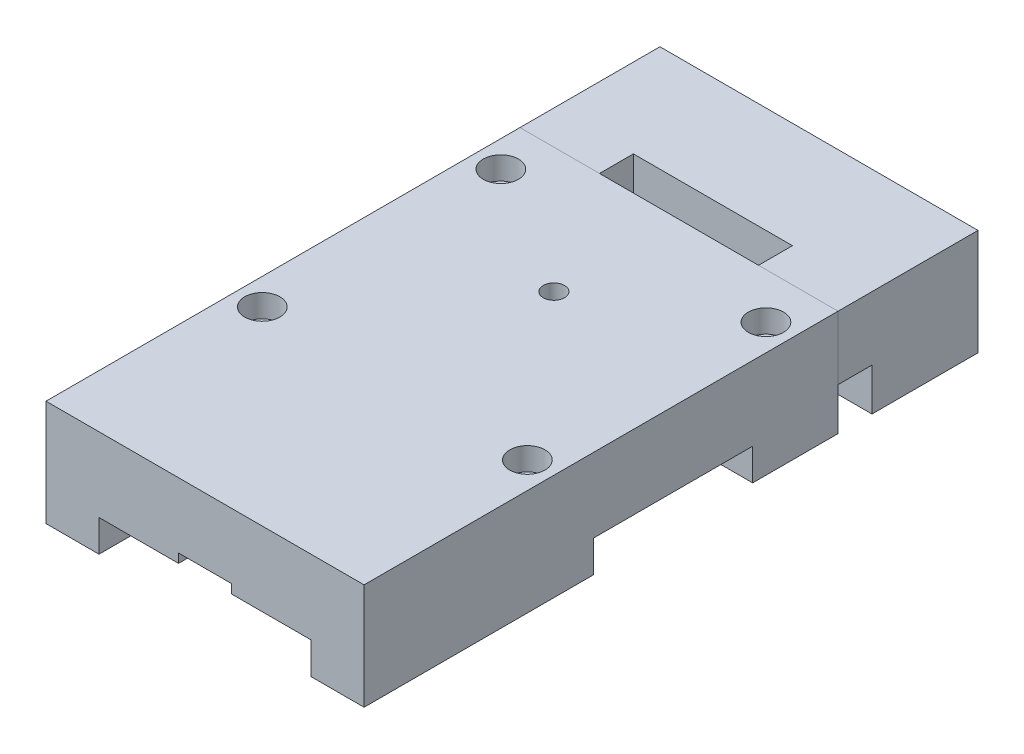
from build123d import *

# Parameters (mm, degrees)
BOSS_EXTRUDE1_DEPTH         = 12.7
BOSS_EXTRUDE1_DEPTH_BACK    = 12.7
SKETCH1_W                   = 76.2
SKETCH1_H                   = 147.066
SKETCH2_R                   = 4.7625
CUT_EXTRUDE1_DEPTH          = 25.4
CUT_EXTRUDE2_DEPTH          = 7.62
CUT_EXTRUDE4_DEPTH          = 84.785452729
CUT_EXTRUDE4_DEPTH_BACK     = 84.785452729
SKETCH5_W                   = 38.1
SKETCH5_H                   = 8.128
F_1_4_20_TAPPED_HOLE1_D     = 5.1054
F_1_4_20_TAPPED_HOLE1_DEPTH = 19.05
F_1_4_20_TAPPED_HOLE1_TIP   = 1.533816902
SKETCH9_R                   = 2.5527
CUT_EXTRUDE5_DEPTH          = 87.62489301
CUT_EXTRUDE7_DEPTH          = 2.159
SKETCH12_R                  = 2.0193
CUT_EXTRUDE8_DEPTH          = 12.7
SKETCH13_W                  = 19.05
SKETCH13_H                  = 8.128
CUT_EXTRUDE9_DEPTH          = 10.16
SKETCH15_R                  = 2.0193
CUT_EXTRUDE11_DEPTH         = 57.15
SKETCH17_R                  = 4.2164
CUT_EXTRUDE12_DEPTH         = 5.461
SKETCH18_R                  = 4.2164
CUT_EXTRUDE13_DEPTH         = 5.461
SKETCH19_R                  = 2.0193
CUT_EXTRUDE14_DEPTH         = 12.7
CUT_EXTRUDE16_DEPTH         = 2.286
CUT_EXTRUDE18_DEPTH         = 11.176


with BuildPart() as part:
    # Sketch1 → Boss-Extrude1 (new, two sides: drawn at the far end of the back side and taken through both)
    with BuildSketch(Plane(origin=(0, 0, 0), x_dir=(1, 0, 0), z_dir=(0, 1, 0)).offset(-BOSS_EXTRUDE1_DEPTH_BACK)):
        Rectangle(SKETCH1_W, SKETCH1_H)
    extrude(amount=BOSS_EXTRUDE1_DEPTH + BOSS_EXTRUDE1_DEPTH_BACK)

    # Sketch2 → Cut-Extrude1 (cut)
    with BuildSketch(Plane(origin=(0, 0, -73.533), x_dir=(-1, 0, 0), z_dir=(0, 0, -1))):
        with Locations((0, -12.7)):
            Circle(SKETCH2_R)
    extrude(amount=-CUT_EXTRUDE1_DEPTH, mode=Mode.SUBTRACT)

    # Sketch3 → Cut-Extrude2 (cut)
    with BuildSketch(Plane(origin=(0, -12.7, 0), x_dir=(-1, 0, 0), z_dir=(0, -1, 0))):
        with BuildLine():
            Line((10.922, 19.558), (44.45, 19.558))
            Line((44.45, 19.558), (44.45, -18.542))
            Line((44.45, -18.542), (25.4, -18.542))
            Line((25.4, -18.542), (25.4, -76.708))
            ThreePointArc((25.4, -76.708), (23.540128061, -81.198128061), (19.05, -83.058))
            Line((19.05, -83.058), (-19.05, -83.058))
            ThreePointArc((-19.05, -83.058), (-23.540128061, -81.198128061), (-25.4, -76.708))
            Line((-25.4, -76.708), (-25.4, -18.542))
            Line((-25.4, -18.542), (-44.45, -18.542))
            Line((-44.45, -18.542), (-44.45, 19.558))
            Line((-44.45, 19.558), (-10.922, 19.558))
            Line((-10.922, 19.558), (-10.922, 40.005))
            Line((-10.922, 40.005), (10.922, 40.005))
            Line((10.922, 40.005), (10.922, 19.558))
        make_face()
    extrude(amount=-CUT_EXTRUDE2_DEPTH, mode=Mode.SUBTRACT)

    # Sketch5 → Cut-Extrude4 (cut, two sides: drawn at the far end of the back side and taken through both)
    with BuildSketch(Plane(origin=(0, 0, 0), x_dir=(1, 0, 0), z_dir=(0, 1, 0)).offset(-CUT_EXTRUDE4_DEPTH_BACK)):
        with Locations((0, 44.069)):
            Rectangle(SKETCH5_W, SKETCH5_H)
    extrude(amount=CUT_EXTRUDE4_DEPTH + CUT_EXTRUDE4_DEPTH_BACK, mode=Mode.SUBTRACT)

    # 1/4-20 Tapped Hole1
    with Locations(Plane(origin=(-11.034450397, 12.7, 14.547513529), x_dir=(-1, 0, 0), z_dir=(0, 1, 0))):
        with Locations((-11.034450397, -24.580513529)):
            Hole(F_1_4_20_TAPPED_HOLE1_D / 2, depth=F_1_4_20_TAPPED_HOLE1_DEPTH)
            with Locations((0, 0, -(F_1_4_20_TAPPED_HOLE1_DEPTH + F_1_4_20_TAPPED_HOLE1_TIP / 2))):  # 118° drill point
                Cone(0, F_1_4_20_TAPPED_HOLE1_D / 2, F_1_4_20_TAPPED_HOLE1_TIP, mode=Mode.SUBTRACT)

    # Sketch9 → Cut-Extrude5 (cut, through all)
    with BuildSketch(Plane(origin=(0, -12.7, 0), x_dir=(-1, 0, 0), z_dir=(0, -1, 0))):
        with Locations((31.75, 29.083)):
            Circle(SKETCH9_R)
        with Locations((31.75, -28.067)):
            Circle(SKETCH9_R)
        with Locations((-31.75, -28.067)):
            Circle(SKETCH9_R)
        with Locations((-31.75, 29.083)):
            Circle(SKETCH9_R)
    extrude(amount=-CUT_EXTRUDE5_DEPTH, mode=Mode.SUBTRACT)

    # Sketch11 → Cut-Extrude7 (cut)
    with BuildSketch(Plane(origin=(0, -5.08, 0), x_dir=(-1, 0, 0), z_dir=(0, -1, 0))):
        with BuildLine():
            Line((0.00254, -32.893), (-0.00254, -32.893))
            ThreePointArc((-0.00254, -32.893), (-4.490872009, -34.752127991), (-6.35, -39.24046))
            Line((-6.35, -39.24046), (-6.35, -73.533))
            Line((-6.35, -73.533), (6.35, -73.533))
            Line((6.35, -73.533), (6.35, -39.24046))
            ThreePointArc((6.35, -39.24046), (4.490872009, -34.752127991), (0.00254, -32.893))
        make_face()
    extrude(amount=-CUT_EXTRUDE7_DEPTH, mode=Mode.SUBTRACT)

    # Sketch12 → Cut-Extrude8 (cut)
    with BuildSketch(Plane.XZ.offset(5.08)):
        with Locations((12.7, 54.483)):
            Circle(SKETCH12_R)
        with Locations((-12.7, 54.483)):
            Circle(SKETCH12_R)
    extrude(amount=-CUT_EXTRUDE8_DEPTH, mode=Mode.SUBTRACT)

    # Sketch13 → Cut-Extrude9 (cut)
    with BuildSketch(Plane.XZ.offset(12.7)):
        with Locations((28.575, -44.069)):
            Rectangle(SKETCH13_W, SKETCH13_H)
    extrude(amount=-CUT_EXTRUDE9_DEPTH, mode=Mode.SUBTRACT)


with BuildPart() as body_2:
    # Split1: the piece on the far side of the plane
    add(part.part)
    split(bisect_by=Plane(origin=(0, 0, -40.005), x_dir=(-1, 0, 0), z_dir=(0, 0, -1)), keep=Keep.BOTTOM)


with BuildPart() as part_1:
    add(part.part)

    # Split1
    split(bisect_by=Plane(origin=(0, 0, -40.005), x_dir=(-1, 0, 0), z_dir=(0, 0, -1)), keep=Keep.TOP)


with BuildPart() as cut_extrude11_tool:
    # Sketch15 → Cut-Extrude11 (new body)
    with BuildSketch(Plane(origin=(0, 0, -73.533), x_dir=(-1, 0, 0), z_dir=(0, 0, -1))):
        with Locations((-24.13, 0)):
            Circle(SKETCH15_R)
        with Locations((24.13, 0)):
            Circle(SKETCH15_R)
    extrude(amount=-CUT_EXTRUDE11_DEPTH)


with BuildPart() as part_2:
    add(part_1.part)

    # Cut-Extrude11: cut by cut_extrude11_tool
    add(cut_extrude11_tool.part, mode=Mode.SUBTRACT)

    # Sketch17 → Cut-Extrude12 (cut)
    with BuildSketch(Plane(origin=(0, 0, -73.533), x_dir=(-1, 0, 0), z_dir=(0, 0, -1))):
        with Locations((-24.13, 0)):
            Circle(SKETCH17_R)
        with Locations((24.13, 0)):
            Circle(SKETCH17_R)
    extrude(amount=-CUT_EXTRUDE12_DEPTH, mode=Mode.SUBTRACT)

    # Sketch19 → Cut-Extrude14 (cut)
    with BuildSketch(Plane.XZ.offset(12.7)):
        with Locations((-31.75, -57.658)):
            Circle(SKETCH19_R)
        with Locations((-12.7, -57.658)):
            Circle(SKETCH19_R)
    extrude(amount=-CUT_EXTRUDE14_DEPTH, mode=Mode.SUBTRACT)


with BuildPart() as body_2_1:
    add(body_2.part)

    # Cut-Extrude11: cut by cut_extrude11_tool
    add(cut_extrude11_tool.part, mode=Mode.SUBTRACT)

    # Sketch18 → Cut-Extrude13 (cut)
    with BuildSketch(Plane(origin=(0, 12.7, 0), x_dir=(1, 0, 0), z_dir=(0, 1, 0))):
        with Locations((31.75, -28.067)):
            Circle(SKETCH18_R)
        with Locations((-31.75, -28.067)):
            Circle(SKETCH18_R)
        with Locations((-31.75, 29.083)):
            Circle(SKETCH18_R)
        with Locations((31.75, 29.083)):
            Circle(SKETCH18_R)
    extrude(amount=-CUT_EXTRUDE13_DEPTH, mode=Mode.SUBTRACT)

    # Sketch22 → Cut-Extrude16 (cut)
    with BuildSketch(Plane.XZ.offset(12.7)):
        with BuildLine():
            Line((-12.7, -35.90925), (12.7, -35.90925))
            ThreePointArc((12.7, -35.90925), (13.49375, -35.1155), (12.7, -34.32175))
            Line((12.7, -34.32175), (-12.7, -34.32175))
            ThreePointArc((-12.7, -34.32175), (-13.49375, -35.1155), (-12.7, -35.90925))
        make_face()
        with BuildLine():
            Line((-12.7, -23.65375), (12.7, -23.65375))
            ThreePointArc((12.7, -23.65375), (13.49375, -24.4475), (12.7, -25.24125))
            Line((12.7, -25.24125), (-12.7, -25.24125))
            ThreePointArc((-12.7, -25.24125), (-13.49375, -24.4475), (-12.7, -23.65375))
        make_face()
    extrude(amount=-CUT_EXTRUDE16_DEPTH, mode=Mode.SUBTRACT)

    # Sketch23 → Cut-Extrude18 (cut)
    with BuildSketch(Plane.XZ.offset(12.7)):
        with BuildLine():
            Line((-10.922, -40.005), (10.922, -40.005))
            Line((10.922, -40.005), (10.922, -22.733))
            ThreePointArc((10.922, -22.733), (9.99206403, -20.48793597), (7.747, -19.558))
            Line((7.747, -19.558), (-7.747, -19.558))
            ThreePointArc((-7.747, -19.558), (-9.99206403, -20.48793597), (-10.922, -22.733))
            Line((-10.922, -22.733), (-10.922, -40.005))
        make_face()
    extrude(amount=-CUT_EXTRUDE18_DEPTH, mode=Mode.SUBTRACT)


solid = Compound([part_2.part, body_2_1.part])
